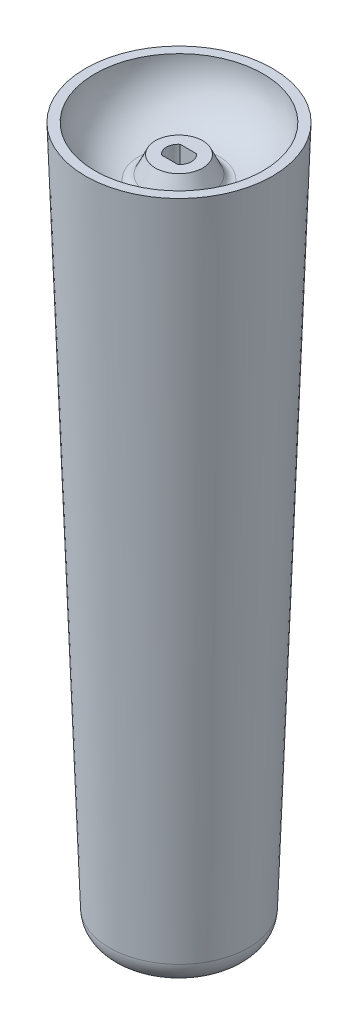
from build123d import *

# Parameters (mm, degrees)
SKETCH4_R           = 5.350481645
CUT_EXTRUDE2_DEPTH  = 3.683
FILLET1_R           = 1.27
SKETCH5_R           = 14.605
BOSS_EXTRUDE2_DEPTH = 101.6
BOSS_EXTRUDE3_START = 8.41019865
SKETCH6_R           = 14.605
SKETCH6_R_2         = 13.707723638
BOSS_EXTRUDE3_DEPTH = 8.41019865
DRAFT2_ANGLE        = -2
FILLET2_R           = 3.81
CUT_EXTRUDE3_DEPTH  = 7.366
DRAFT3_ANGLE        = 1


# Read off the part's stored shape, not the designer's step: Boss-Extrude1
with BuildPart() as part:
    # Sketch1 → Revolve1 (revolve)
    with BuildSketch(Plane.XY, mode=Mode.PRIVATE) as revolve1_sk:
        with BuildLine():
            Line((0, 0), (0, -7.747))
            Line((0, -7.747), (5.588, -7.747))
            ThreePointArc((5.588, -7.747), (11.354881185, -5.189962282), (13.707723638, 0.66319865))
            Line((13.707723638, 0.66319865), (13.145278313, 0.66319865))
            ThreePointArc((13.145278313, 0.66319865), (10.874067339, -4.877120177), (5.350481645, -7.188728508))
            Line((5.350481645, -7.188728508), (3.466052478, -3.180343574))
            Line((3.466052478, -3.180343574), (3.466052478, 0))
            Line((3.466052478, 0), (0, 0))
        make_face()
    revolve(revolve1_sk.sketch.rotate(Axis((0, 0, 0), (0, -1, 0)), 90), axis=Axis((0, 0, 0), (0, -1, 0)))

    # Boss-Extrude1 outline → Boss-Extrude1 (revolve)
    with BuildSketch(Plane.XY):
        with BuildLine():
            Line((13.707723638, -7.747), (13.707723638, 0.606068215))
            ThreePointArc((13.707723638, 0.606068215), (11.335005533, -5.21047892), (5.588, -7.747))
            Line((5.588, -7.747), (13.707723638, -7.747))
        make_face()
    revolve(axis=Axis((0, 0, 0), (0, 1, 0)))

    # Sketch4 → Cut-Extrude2 (cut)
    with BuildSketch(Plane(origin=(0, 0, 0), x_dir=(1, 0, 0), z_dir=(0, 1, 0))):
        Circle(SKETCH4_R)
    extrude(amount=-CUT_EXTRUDE2_DEPTH, mode=Mode.SUBTRACT)

    # Fillet1
    fillet1_edges = [part.edges().sort_by_distance(p)[0] for p in [
        (0, -7.188728508, -5.350481645),
    ]]
    fillet(fillet1_edges, radius=FILLET1_R)

    # Sketch5 → Boss-Extrude2 (add)
    with BuildSketch(Plane.XZ.offset(7.747)):
        with Locations(Location((0, 0, 0), (0, 0, 270))):
            Circle(SKETCH5_R)
    extrude(amount=BOSS_EXTRUDE2_DEPTH)

    # Sketch6 → Boss-Extrude3 (add)
    with BuildSketch(Plane(origin=(0, -7.747, 0), x_dir=(1, 0, 0), z_dir=(0, 1, 0)).offset(BOSS_EXTRUDE3_START)):
        with Locations(Location((0, 0, 0), (0, 0, 90))):
            Circle(SKETCH6_R)
        Circle(SKETCH6_R_2, mode=Mode.SUBTRACT)
    extrude(amount=-BOSS_EXTRUDE3_DEPTH)

    # Draft2
    draft2_faces = [part.faces().sort_by_distance(p)[0] for p in [
        (0, -54.341900675, 14.605),
    ]]
    draft(draft2_faces, Plane(origin=(13.707723638, 0.66319865, 0), x_dir=(0, 0, 1), z_dir=(0, 1, 0)), DRAFT2_ANGLE)

    # Fillet2
    fillet2_edges = [part.edges().sort_by_distance(p)[0] for p in [
        (0, -109.347, 10.763359211),
    ]]
    fillet(fillet2_edges, radius=FILLET2_R)

    # Sketch7 → Cut-Extrude3 (cut)
    with BuildSketch(Plane(origin=(0, -3.683, 0), x_dir=(1, 0, 0), z_dir=(0, 1, 0))):
        with BuildLine():
            Line((1.27, -1.4605), (-1.27, -1.4605))
            ThreePointArc((-1.27, -1.4605), (-1.9685, 0), (-1.27, 1.4605))
            Line((-1.27, 1.4605), (1.27, 1.4605))
            ThreePointArc((1.27, 1.4605), (1.9685, 0), (1.27, -1.4605))
        make_face()
    extrude(amount=-CUT_EXTRUDE3_DEPTH, mode=Mode.SUBTRACT)

    # Draft3
    draft3_faces = [part.faces().sort_by_distance(p)[0] for p in [
        (-1.9685, -7.366, 0),
        (0, -7.366, -1.4605),
        (0, -7.366, 1.4605),
        (1.9685, -7.366, 0),
    ]]
    draft(draft3_faces, Plane.ZX.offset(-3.683), DRAFT3_ANGLE)


solid = part.part
